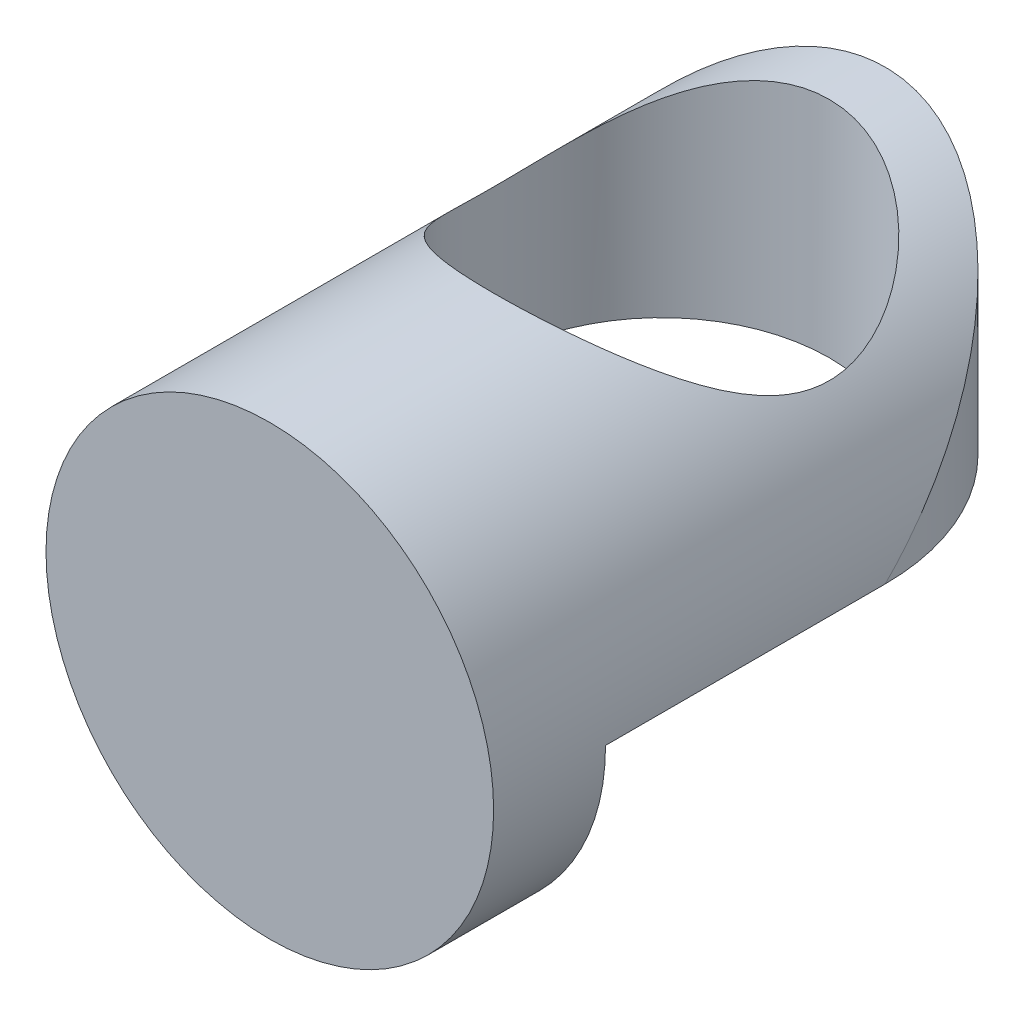
from build123d import *

# Parameters (mm, degrees)
SKETCH1_R           = 25.4
BOSS_EXTRUDE1_DEPTH = 12.7
SKETCH2_R           = 25.4
SKETCH2_W           = 50.8
SKETCH2_H           = 31.75
BOSS_EXTRUDE2_DEPTH = 25.4
CUT_EXTRUDE1_DEPTH  = 68.501425911
SKETCH4_R           = 19.05
CUT_EXTRUDE2_DEPTH  = 68.501425911


with BuildPart() as part:
    # Sketch1 → Boss-Extrude1 (new body)
    with BuildSketch(Plane.XY):
        Circle(SKETCH1_R)
    extrude(amount=BOSS_EXTRUDE1_DEPTH)

    # Sketch2 → Boss-Extrude2 (add)
    with BuildSketch(Plane(origin=(0, 0, 0), x_dir=(1, 0, 0), z_dir=(0, 1, 0))):
        with Locations((0, 31.75)):
            Circle(SKETCH2_R)
        with Locations((0, 15.875)):
            Rectangle(SKETCH2_W, SKETCH2_H)
    extrude(amount=BOSS_EXTRUDE2_DEPTH)

    # Sketch3 → Cut-Extrude1 (cut, through all)
    with BuildSketch(Plane.XY):
        with BuildLine():
            ThreePointArc((0, 25.4), (17.960512242, 17.960512242), (25.4, 0))
            Line((25.4, 0), (25.4, 25.4))
            Line((25.4, 25.4), (0, 25.4))
        make_face()
        with BuildLine():
            ThreePointArc((-25.4, 0), (-17.960512242, 17.960512242), (0, 25.4))
            Line((0, 25.4), (-25.4, 25.4))
            Line((-25.4, 25.4), (-25.4, 0))
        make_face()
    extrude(amount=-CUT_EXTRUDE1_DEPTH, mode=Mode.SUBTRACT)

    # Sketch4 → Cut-Extrude2 (cut, through all)
    with BuildSketch(Plane.XZ):
        with Locations((0, -31.75)):
            Circle(SKETCH4_R)
    extrude(amount=-CUT_EXTRUDE2_DEPTH, mode=Mode.SUBTRACT)


solid = part.part
